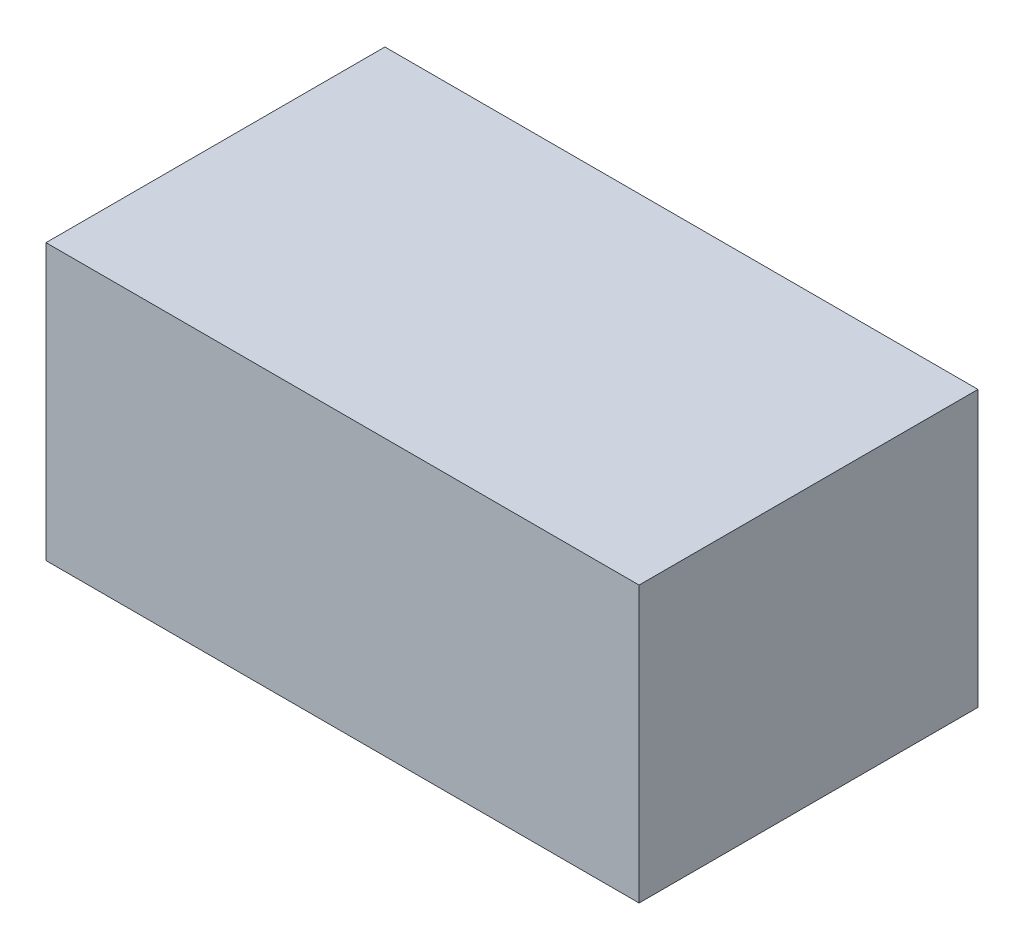
from build123d import *

# Parameters (mm, degrees)
SKETCH1_W           = 140
SKETCH1_H           = 80
BOSS_EXTRUDE1_DEPTH = 65


with BuildPart() as part:
    # Sketch1 → Boss-Extrude1 (new body)
    with BuildSketch(Plane(origin=(0, 0, 0), x_dir=(1, 0, 0), z_dir=(0, 1, 0))):
        Rectangle(SKETCH1_W, SKETCH1_H)
    extrude(amount=BOSS_EXTRUDE1_DEPTH)


solid = part.part
